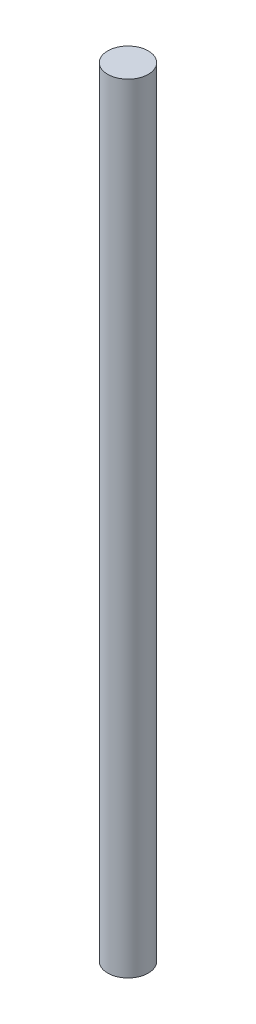
from build123d import *

# Parameters (mm, degrees)
SKETCH1_R           = 2.609499656
BOSS_EXTRUDE1_DEPTH = 100


with BuildPart() as part:
    # Sketch1 → Boss-Extrude1 (new body)
    with BuildSketch(Plane(origin=(0, 0, 0), x_dir=(1, 0, 0), z_dir=(0, 1, 0))):
        Circle(SKETCH1_R)
    extrude(amount=BOSS_EXTRUDE1_DEPTH)


solid = part.part
